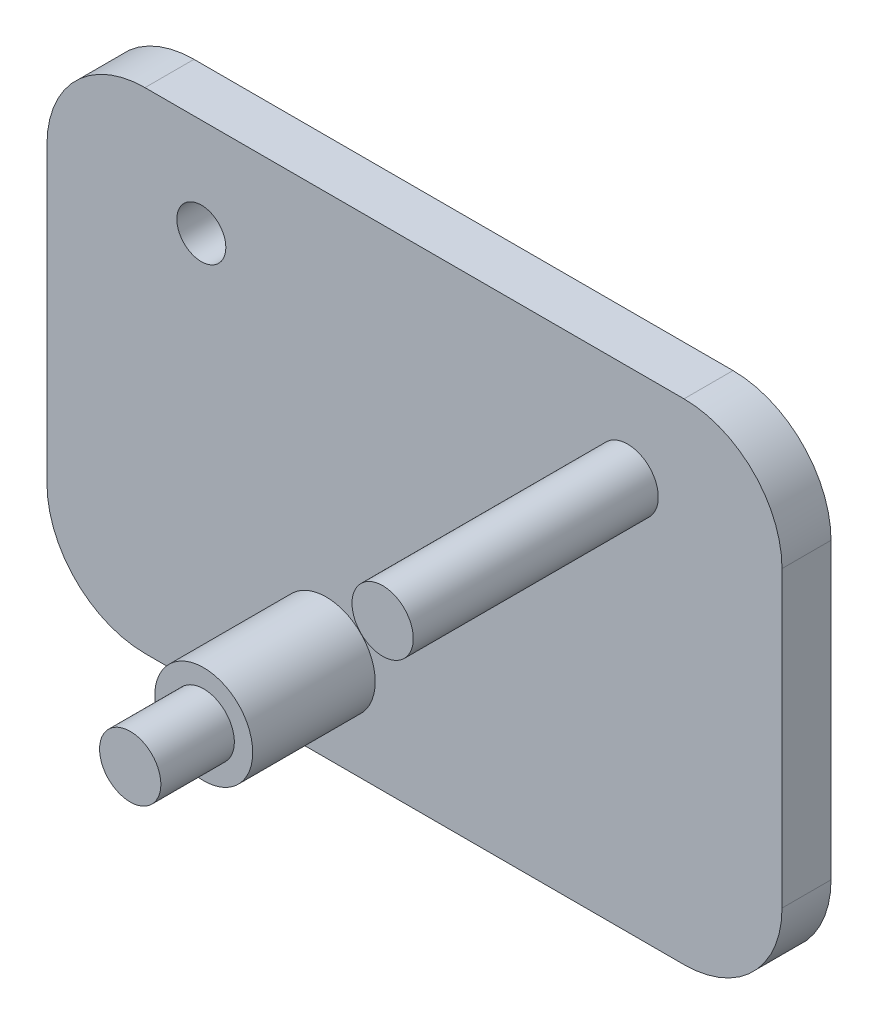
from build123d import *

# Parameters (mm, degrees)
SKETCH1_W           = 38.1
SKETCH1_H           = 25.4
BOSS_EXTRUDE1_DEPTH = 2.54
SKETCH2_R           = 1.5875
SKETCH2_R_2         = 1.27
BOSS_EXTRUDE2_DEPTH = 12.7
SKETCH5_R           = 1.27
CUT_EXTRUDE1_DEPTH  = 49.26
SKETCH6_R           = 2.54
BOSS_EXTRUDE3_DEPTH = 6.35
CUT_EXTRUDE2_START  = -2.54
SKETCH7_R           = 1.5875
CUT_EXTRUDE2_DEPTH  = 2.54
FILLET1_R           = 5.08


with BuildPart() as part:
    # Sketch1 → Boss-Extrude1 (new body)
    with BuildSketch(Plane.XY):
        with Locations((-19.05, -12.7)):
            Rectangle(SKETCH1_W, SKETCH1_H)
    extrude(amount=BOSS_EXTRUDE1_DEPTH)

    # Sketch2 → Boss-Extrude2 (add)
    with BuildSketch(Plane.XY.offset(2.54)):
        with Locations((-8.001, -5.08)):
            Circle(SKETCH2_R)
        with Locations((-23.626645651, -20.705645651)):
            Circle(SKETCH2_R)
        with Locations((-30.099, -5.08)):
            Circle(SKETCH2_R_2)
    extrude(amount=BOSS_EXTRUDE2_DEPTH)

    # Sketch5 → Cut-Extrude1 (cut, through all)
    with BuildSketch(Plane.XY.offset(15.24)):
        with Locations((-30.099, -5.08)):
            Circle(SKETCH5_R)
    extrude(amount=-CUT_EXTRUDE1_DEPTH, mode=Mode.SUBTRACT)

    # Sketch6 → Boss-Extrude3 (add)
    with BuildSketch(Plane.XY.offset(2.54)):
        with Locations((-23.626645651, -20.705645651)):
            Circle(SKETCH6_R)
    extrude(amount=BOSS_EXTRUDE3_DEPTH)

    # Sketch7 → Cut-Extrude2 (cut)
    with BuildSketch(Plane.XY.offset(15.24).offset(CUT_EXTRUDE2_START)):
        with Locations((-23.626645651, -20.705645651)):
            Circle(SKETCH7_R)
    extrude(amount=CUT_EXTRUDE2_DEPTH, mode=Mode.SUBTRACT)

    # Fillet1
    fillet1_edges = [part.edges().sort_by_distance(p)[0] for p in [
        (0, 0, 1.27),
        (0, -25.4, 1.27),
        (-38.1, 0, 1.27),
        (-38.1, -25.4, 1.27),
    ]]
    fillet(fillet1_edges, radius=FILLET1_R)


solid = part.part
